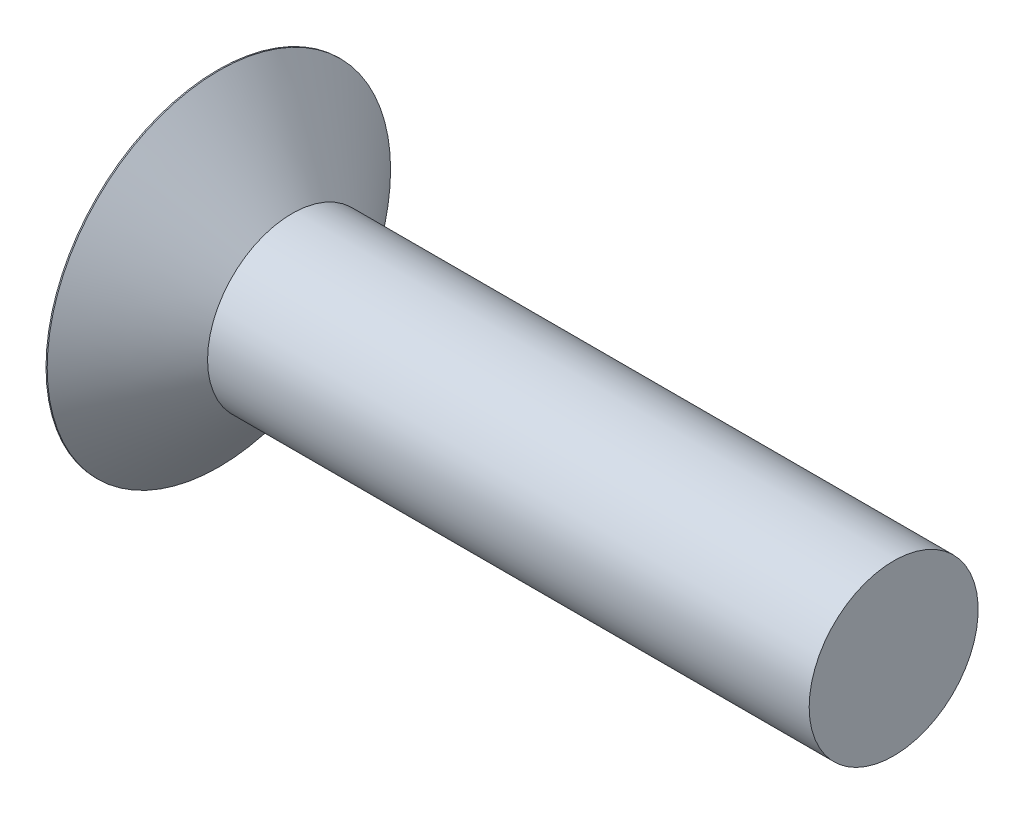
from build123d import *

# Parameters (mm, degrees)
CIRPATTERN1_COUNT = 2
CIRPATTERN1_ANGLE = 90


with BuildPart() as part:
    # BodySke → Base-Revolve (revolve)
    with BuildSketch(Plane.XY):
        Polygon((0, 0), (0, 9.6774), (0.066909223, 9.6774), (4.191, 4.7625), (38.1, 4.7625), (38.1, 0), align=None)
    revolve(axis=Axis((-6.35, 0, 0), (1, 0, 0)))

    # Sketch3 → Cross section 0
    with BuildSketch(Plane.ZY):
        with BuildLine():
            Line((-1.0922, 6.6421), (1.0922, 6.6421))
            Line((1.0922, 6.6421), (1.0922, -6.6421))
            Line((1.0922, -6.6421), (-1.0922, -6.6421))
            Line((-1.0922, -6.6421), (-1.0922, 6.6421))
        make_face()
    # Sketch4 → Cross section 1
    with BuildSketch(Plane.ZY.offset(-7.9756)):
        with BuildLine():
            Line((-0.5461, 0.5461), (0.5461, 0.5461))
            Line((0.5461, 0.5461), (0.5461, -0.5461))
            Line((0.5461, -0.5461), (-0.5461, -0.5461))
            Line((-0.5461, -0.5461), (-0.5461, 0.5461))
        make_face()
    cross = loft(mode=Mode.SUBTRACT)

    # CirPattern1: Cross ×2 about axis
    cirpattern1_axis = Axis((-6.35, 0, 0), (1, 0, 0))
    for i in range(1, CIRPATTERN1_COUNT):
        add(cross.rotate(cirpattern1_axis, i * CIRPATTERN1_ANGLE / (CIRPATTERN1_COUNT - 1)), mode=Mode.SUBTRACT)


solid = part.part
